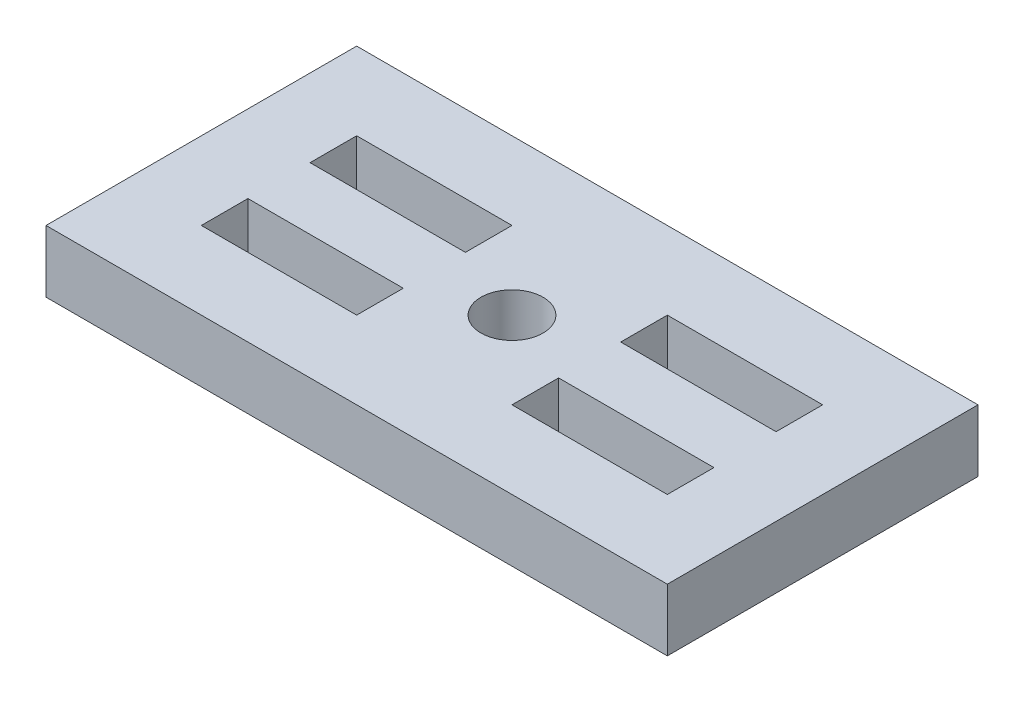
from build123d import *

# Parameters (mm, degrees)
SKETCH1_W           = 20
SKETCH1_H           = 10
BOSS_EXTRUDE1_DEPTH = 2
SKETCH3_W           = 5
SKETCH3_H           = 1.5
CUT_EXTRUDE1_DEPTH  = 2
SKETCH2_R           = 1
CUT_EXTRUDE2_DEPTH  = 2


with BuildPart() as part:
    # Sketch1 → Boss-Extrude1 (new body)
    with BuildSketch(Plane(origin=(0, 0, 0), x_dir=(1, 0, 0), z_dir=(0, 1, 0))):
        with Locations((2.275132275, -0.37037037)):
            Rectangle(SKETCH1_W, SKETCH1_H)
    extrude(amount=BOSS_EXTRUDE1_DEPTH)

    # Sketch3 → Cut-Extrude1 (cut)
    with BuildSketch(Plane(origin=(0, 2, 0), x_dir=(1, 0, 0), z_dir=(0, 1, 0))):
        with Locations((-2.724867725, 1.37962963)):
            Rectangle(SKETCH3_W, SKETCH3_H)
        with Locations((7.275132275, 1.37962963)):
            Rectangle(SKETCH3_W, SKETCH3_H)
        with Locations((7.275132275, -2.12037037)):
            Rectangle(SKETCH3_W, SKETCH3_H)
        with Locations((-2.724867725, -2.12037037)):
            Rectangle(SKETCH3_W, SKETCH3_H)
    extrude(amount=-CUT_EXTRUDE1_DEPTH, mode=Mode.SUBTRACT)

    # Sketch2 → Cut-Extrude2 (cut)
    with BuildSketch(Plane(origin=(0, 2, 0), x_dir=(1, 0, 0), z_dir=(0, 1, 0))):
        with Locations((2.275132275, -0.37037037)):
            Circle(SKETCH2_R)
    extrude(amount=-CUT_EXTRUDE2_DEPTH, mode=Mode.SUBTRACT)


solid = part.part
